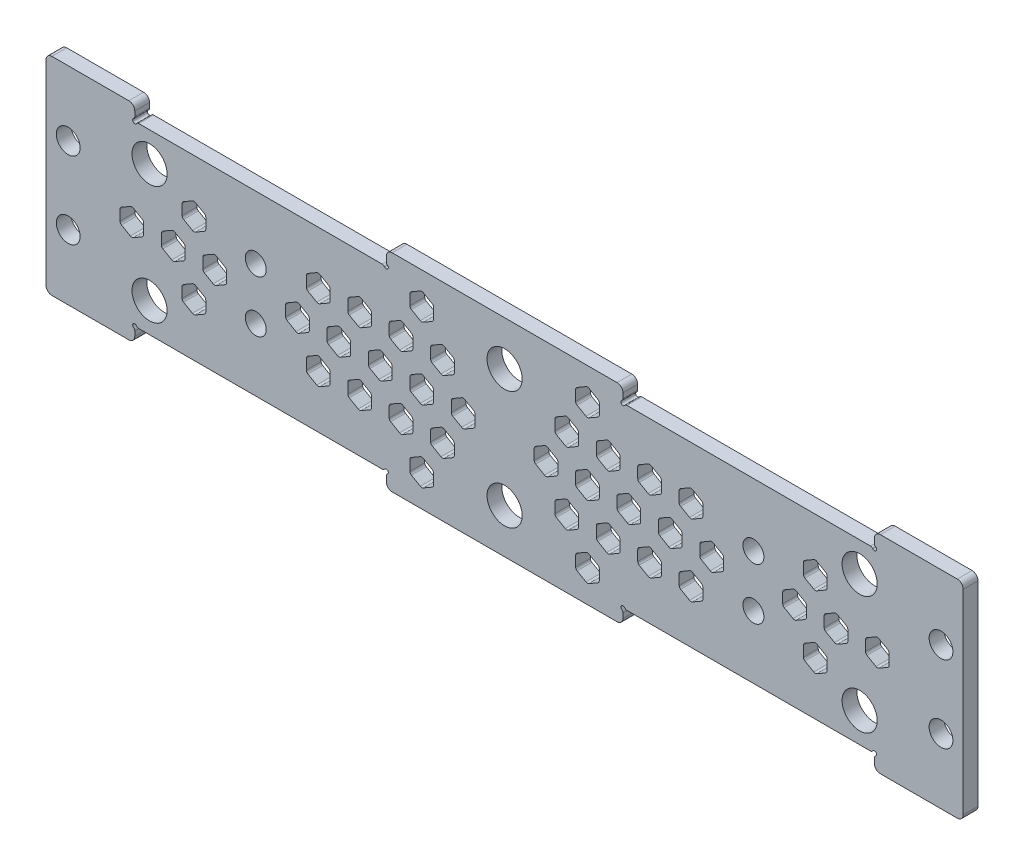
from build123d import *

# Parameters (mm, degrees)
STOCK_HAMMERSAW_START                   = 19.05
STOCK_HAMMERSAW_MULTIBODY_1_OUTLINE_R   = 3.77063
STOCK_HAMMERSAW_MULTIBODY_1_OUTLINE_R_2 = 2.5527
STOCK_HAMMERSAW_MULTIBODY_1_OUTLINE_R_3 = 2.2479
STOCK_HAMMERSAW_MULTIBODY_1_DEPTH       = 3.175
CUT_EXTRUDE1_DEPTH                      = 113.298093817
FILLET3_R                               = 0.635
LPATTERN1_COUNT                         = 11
LPATTERN1_PITCH                         = 8.89
LPATTERN1_COUNT_DIR2                    = 11
LPATTERN1_PITCH_DIR2                    = 8.89
FILLET3_OF_LPATTERN1_R                  = 0.635
MIRROR1_START                           = 19.05
MIRROR1_DEPTH                           = 3.175
SKETCH2_R                               = 0.4445
CUT_EXTRUDE2_DEPTH                      = 113.298093817
FILLET1_R                               = 0.635
FILLET2_R                               = 1.27


# Read off the part's stored shape, not the designer's step: Stock-HammerSaw Multibody-1, Mirror1
with BuildPart() as part:
    # Stock-HammerSaw Multibody-1 outline → Stock-HammerSaw Multibody-1 (new body)
    with BuildSketch(Plane.XY.offset(STOCK_HAMMERSAW_START)):
        Polygon((79.375, 50.8), (25.4, 50.8), (25.4, 53.975), (-25.4, 53.975), (-25.4, 50.8), (-79.375, 50.8), (-79.375, 53.975), (-98.425, 53.975), (-98.425, 9.525), (-79.375, 9.525), (-79.375, 12.7), (-25.4, 12.7), (-25.4, 9.525), (25.4, 9.525), (25.4, 12.7), (79.375, 12.7), (79.375, 9.525), (98.425, 9.525), (98.425, 53.975), (79.375, 53.975), align=None)
        with Locations((-76.2, 19.05)):
            Circle(STOCK_HAMMERSAW_MULTIBODY_1_OUTLINE_R, mode=Mode.SUBTRACT)
        with Locations((-93.6625, 23.495)):
            Circle(STOCK_HAMMERSAW_MULTIBODY_1_OUTLINE_R_2, mode=Mode.SUBTRACT)
        with Locations((-53.4035, 26.19375)):
            Circle(STOCK_HAMMERSAW_MULTIBODY_1_OUTLINE_R_3, mode=Mode.SUBTRACT)
        with Locations((0, 19.05)):
            Circle(STOCK_HAMMERSAW_MULTIBODY_1_OUTLINE_R, mode=Mode.SUBTRACT)
        with Locations((76.2, 19.05)):
            Circle(STOCK_HAMMERSAW_MULTIBODY_1_OUTLINE_R, mode=Mode.SUBTRACT)
        with Locations((93.6625, 23.495)):
            Circle(STOCK_HAMMERSAW_MULTIBODY_1_OUTLINE_R_2, mode=Mode.SUBTRACT)
        with Locations((53.4035, 26.19375)):
            Circle(STOCK_HAMMERSAW_MULTIBODY_1_OUTLINE_R_3, mode=Mode.SUBTRACT)
        with Locations((-93.6625, 40.005)):
            Circle(STOCK_HAMMERSAW_MULTIBODY_1_OUTLINE_R_2, mode=Mode.SUBTRACT)
        with Locations((-53.4035, 37.30625)):
            Circle(STOCK_HAMMERSAW_MULTIBODY_1_OUTLINE_R_3, mode=Mode.SUBTRACT)
        with Locations((-76.2, 44.45)):
            Circle(STOCK_HAMMERSAW_MULTIBODY_1_OUTLINE_R, mode=Mode.SUBTRACT)
        with Locations((53.4035, 37.30625)):
            Circle(STOCK_HAMMERSAW_MULTIBODY_1_OUTLINE_R_3, mode=Mode.SUBTRACT)
        with Locations((93.6625, 40.005)):
            Circle(STOCK_HAMMERSAW_MULTIBODY_1_OUTLINE_R_2, mode=Mode.SUBTRACT)
        with Locations((0, 44.45)):
            Circle(STOCK_HAMMERSAW_MULTIBODY_1_OUTLINE_R, mode=Mode.SUBTRACT)
        with Locations((76.2, 44.45)):
            Circle(STOCK_HAMMERSAW_MULTIBODY_1_OUTLINE_R, mode=Mode.SUBTRACT)
    extrude(amount=STOCK_HAMMERSAW_MULTIBODY_1_DEPTH)

    # Sketch1 → Cut-Extrude1 (cut, through all)
    with BuildSketch(Plane.XY.offset(22.225)):
        Polygon((-6.35, 30.283530316), (-6.35, 33.216469684), (-8.89, 34.682939367), (-11.43, 33.216469684), (-11.43, 30.283530316), (-8.89, 28.817060633), align=None)
    cut_extrude1 = extrude(amount=-CUT_EXTRUDE1_DEPTH, mode=Mode.SUBTRACT)

    # Fillet3
    fillet3_edges = [part.edges().sort_by_distance(p)[0] for p in [
        (-6.35, 30.283530316, 20.6375),
        (-8.89, 28.817060633, 20.6375),
        (-11.43, 30.283530316, 20.6375),
        (-11.43, 33.216469684, 20.6375),
        (-8.89, 34.682939367, 20.6375),
        (-6.35, 33.216469684, 20.6375),
    ]]
    fillet(fillet3_edges, radius=FILLET3_R)

    # LPattern1: Cut-Extrude1 11 × 11, 100 skipped
    with Locations(*[Vector(0.5000000000000003, 0.8660254037844385, 0) * (i * LPATTERN1_PITCH) + Vector(0.5, -0.8660254037844387, 0) * (j * LPATTERN1_PITCH_DIR2) for i in range(LPATTERN1_COUNT) for j in range(LPATTERN1_COUNT_DIR2) if (i, j) not in ((0, 0), (0, 1), (0, 2), (0, 3), (0, 4), (0, 5), (0, 6), (0, 7), (0, 8), (0, 9), (0, 10), (1, 0), (1, 1), (1, 2), (1, 3), (1, 4), (1, 5), (1, 6), (1, 7), (1, 8), (1, 9), (1, 10), (2, 0), (2, 1), (2, 5), (2, 6), (2, 7), (2, 8), (2, 9), (2, 10), (3, 0), (3, 1), (3, 5), (3, 6), (3, 7), (3, 8), (3, 9), (3, 10), (4, 0), (4, 1), (4, 6), (4, 7), (4, 8), (4, 9), (4, 10), (5, 0), (5, 1), (5, 2), (5, 3), (5, 7), (5, 8), (5, 9), (5, 10), (6, 0), (6, 1), (6, 2), (6, 3), (6, 4), (6, 7), (6, 8), (6, 9), (6, 10), (7, 0), (7, 1), (7, 2), (7, 3), (7, 4), (7, 5), (7, 6), (7, 7), (7, 8), (7, 9), (7, 10), (8, 0), (8, 1), (8, 2), (8, 3), (8, 4), (8, 5), (8, 6), (8, 7), (8, 10), (9, 0), (9, 1), (9, 2), (9, 3), (9, 4), (9, 5), (9, 6), (9, 7), (9, 10), (10, 0), (10, 1), (10, 2), (10, 3), (10, 4), (10, 5), (10, 6), (10, 7), (10, 8), (10, 9))]):
        add(cut_extrude1, mode=Mode.SUBTRACT)

    # Fillet3 of LPattern1
    fillet3_of_lpattern1_edges = [part.edges().sort_by_distance(p)[0] for p in [
        (11.43, 30.283530316, 20.6375),
        (8.89, 28.817060633, 20.6375),
        (6.35, 30.283530316, 20.6375),
        (6.35, 33.216469684, 20.6375),
        (8.89, 34.682939367, 20.6375),
        (11.43, 33.216469684, 20.6375),
        (15.875, 22.584564477, 20.6375),
        (13.335, 21.118094793, 20.6375),
        (10.795, 22.584564477, 20.6375),
        (10.795, 25.517503844, 20.6375),
        (13.335, 26.983973528, 20.6375),
        (15.875, 25.517503844, 20.6375),
        (20.32, 14.885598637, 20.6375),
        (17.78, 13.419128953, 20.6375),
        (15.24, 14.885598637, 20.6375),
        (15.24, 17.818538004, 20.6375),
        (17.78, 19.285007688, 20.6375),
        (20.32, 17.818538004, 20.6375),
        (15.875, 37.982496156, 20.6375),
        (13.335, 36.516026472, 20.6375),
        (10.795, 37.982496156, 20.6375),
        (10.795, 40.915435523, 20.6375),
        (13.335, 42.381905207, 20.6375),
        (15.875, 40.915435523, 20.6375),
        (20.32, 30.283530316, 20.6375),
        (17.78, 28.817060633, 20.6375),
        (15.24, 30.283530316, 20.6375),
        (15.24, 33.216469684, 20.6375),
        (17.78, 34.682939367, 20.6375),
        (20.32, 33.216469684, 20.6375),
        (24.765, 22.584564477, 20.6375),
        (22.225, 21.118094793, 20.6375),
        (19.685, 22.584564477, 20.6375),
        (19.685, 25.517503844, 20.6375),
        (22.225, 26.983973528, 20.6375),
        (24.765, 25.517503844, 20.6375),
        (20.32, 45.681461996, 20.6375),
        (17.78, 44.214992312, 20.6375),
        (15.24, 45.681461996, 20.6375),
        (15.24, 48.614401363, 20.6375),
        (17.78, 50.080871047, 20.6375),
        (20.32, 48.614401363, 20.6375),
        (24.765, 37.982496156, 20.6375),
        (22.225, 36.516026472, 20.6375),
        (19.685, 37.982496156, 20.6375),
        (19.685, 40.915435523, 20.6375),
        (22.225, 42.381905207, 20.6375),
        (24.765, 40.915435523, 20.6375),
        (29.21, 30.283530316, 20.6375),
        (26.67, 28.817060633, 20.6375),
        (24.13, 30.283530316, 20.6375),
        (24.13, 33.216469684, 20.6375),
        (26.67, 34.682939367, 20.6375),
        (29.21, 33.216469684, 20.6375),
        (33.655, 22.584564477, 20.6375),
        (31.115, 21.118094793, 20.6375),
        (28.575, 22.584564477, 20.6375),
        (28.575, 25.517503844, 20.6375),
        (31.115, 26.983973528, 20.6375),
        (33.655, 25.517503844, 20.6375),
        (33.655, 37.982496156, 20.6375),
        (31.115, 36.516026472, 20.6375),
        (28.575, 37.982496156, 20.6375),
        (28.575, 40.915435523, 20.6375),
        (31.115, 42.381905207, 20.6375),
        (33.655, 40.915435523, 20.6375),
        (38.1, 30.283530316, 20.6375),
        (35.56, 28.817060633, 20.6375),
        (33.02, 30.283530316, 20.6375),
        (33.02, 33.216469684, 20.6375),
        (35.56, 34.682939367, 20.6375),
        (38.1, 33.216469684, 20.6375),
        (42.545, 22.584564477, 20.6375),
        (40.005, 21.118094793, 20.6375),
        (37.465, 22.584564477, 20.6375),
        (37.465, 25.517503844, 20.6375),
        (40.005, 26.983973528, 20.6375),
        (42.545, 25.517503844, 20.6375),
        (42.545, 37.982496156, 20.6375),
        (40.005, 36.516026472, 20.6375),
        (37.465, 37.982496156, 20.6375),
        (37.465, 40.915435523, 20.6375),
        (40.005, 42.381905207, 20.6375),
        (42.545, 40.915435523, 20.6375),
        (46.99, 30.283530316, 20.6375),
        (44.45, 28.817060633, 20.6375),
        (41.91, 30.283530316, 20.6375),
        (41.91, 33.216469684, 20.6375),
        (44.45, 34.682939367, 20.6375),
        (46.99, 33.216469684, 20.6375),
        (64.77, 30.283530316, 20.6375),
        (62.23, 28.817060633, 20.6375),
        (59.69, 30.283530316, 20.6375),
        (59.69, 33.216469684, 20.6375),
        (62.23, 34.682939367, 20.6375),
        (64.77, 33.216469684, 20.6375),
        (69.215, 22.584564477, 20.6375),
        (66.675, 21.118094793, 20.6375),
        (64.135, 22.584564477, 20.6375),
        (64.135, 25.517503844, 20.6375),
        (66.675, 26.983973528, 20.6375),
        (69.215, 25.517503844, 20.6375),
        (69.215, 37.982496156, 20.6375),
        (66.675, 36.516026472, 20.6375),
        (64.135, 37.982496156, 20.6375),
        (64.135, 40.915435523, 20.6375),
        (66.675, 42.381905207, 20.6375),
        (69.215, 40.915435523, 20.6375),
        (73.66, 30.283530316, 20.6375),
        (71.12, 28.817060633, 20.6375),
        (68.58, 30.283530316, 20.6375),
        (68.58, 33.216469684, 20.6375),
        (71.12, 34.682939367, 20.6375),
        (73.66, 33.216469684, 20.6375),
        (82.55, 30.283530316, 20.6375),
        (80.01, 28.817060633, 20.6375),
        (77.47, 30.283530316, 20.6375),
        (77.47, 33.216469684, 20.6375),
        (80.01, 34.682939367, 20.6375),
        (82.55, 33.216469684, 20.6375),
    ]]
    fillet(fillet3_of_lpattern1_edges, radius=FILLET3_OF_LPATTERN1_R)

    # Mirror1 outline → Mirror1 (cut)
    with BuildSketch(Plane.XY.offset(MIRROR1_START)):
        with BuildLine():
            Line((-21.9075, 21.301403503), (-20.0025, 22.401255766))
            ThreePointArc((-20.0025, 22.401255766), (-19.770073869, 22.633681898), (-19.685, 22.951181898))
            Line((-19.685, 22.951181898), (-19.685, 25.150886423))
            ThreePointArc((-19.685, 25.150886423), (-19.770073869, 25.468386423), (-20.0025, 25.700812555))
            Line((-20.0025, 25.700812555), (-21.9075, 26.800664817))
            ThreePointArc((-21.9075, 26.800664817), (-22.225, 26.885738686), (-22.5425, 26.800664817))
            Line((-22.5425, 26.800664817), (-24.4475, 25.700812555))
            ThreePointArc((-24.4475, 25.700812555), (-24.679926131, 25.468386423), (-24.765, 25.150886423))
            Line((-24.765, 25.150886423), (-24.765, 22.951181898))
            ThreePointArc((-24.765, 22.951181898), (-24.679926131, 22.633681898), (-24.4475, 22.401255766))
            Line((-24.4475, 22.401255766), (-22.5425, 21.301403503))
            ThreePointArc((-22.5425, 21.301403503), (-22.225, 21.216329635), (-21.9075, 21.301403503))
        make_face()
        with BuildLine():
            Line((-24.4475, 37.799187445), (-22.5425, 36.699335183))
            ThreePointArc((-22.5425, 36.699335183), (-22.225, 36.614261314), (-21.9075, 36.699335183))
            Line((-21.9075, 36.699335183), (-20.0025, 37.799187445))
            ThreePointArc((-20.0025, 37.799187445), (-19.770073869, 38.031613577), (-19.685, 38.349113577))
            Line((-19.685, 38.349113577), (-19.685, 40.548818102))
            ThreePointArc((-19.685, 40.548818102), (-19.770073869, 40.866318102), (-20.0025, 41.098744234))
            Line((-20.0025, 41.098744234), (-21.9075, 42.198596497))
            ThreePointArc((-21.9075, 42.198596497), (-22.225, 42.283670365), (-22.5425, 42.198596497))
            Line((-22.5425, 42.198596497), (-24.4475, 41.098744234))
            ThreePointArc((-24.4475, 41.098744234), (-24.679926131, 40.866318102), (-24.765, 40.548818102))
            Line((-24.765, 40.548818102), (-24.765, 38.349113577))
            ThreePointArc((-24.765, 38.349113577), (-24.679926131, 38.031613577), (-24.4475, 37.799187445))
        make_face()
        with BuildLine():
            Line((-17.4625, 13.602437664), (-15.5575, 14.702289927))
            ThreePointArc((-15.5575, 14.702289927), (-15.325073869, 14.934716058), (-15.24, 15.252216058))
            Line((-15.24, 15.252216058), (-15.24, 17.451920584))
            ThreePointArc((-15.24, 17.451920584), (-15.325073869, 17.769420584), (-15.5575, 18.001846715))
            Line((-15.5575, 18.001846715), (-17.4625, 19.101698978))
            ThreePointArc((-17.4625, 19.101698978), (-17.78, 19.186772846), (-18.0975, 19.101698978))
            Line((-18.0975, 19.101698978), (-20.0025, 18.001846715))
            ThreePointArc((-20.0025, 18.001846715), (-20.234926131, 17.769420584), (-20.32, 17.451920584))
            Line((-20.32, 17.451920584), (-20.32, 15.252216058))
            ThreePointArc((-20.32, 15.252216058), (-20.234926131, 14.934716058), (-20.0025, 14.702289927))
            Line((-20.0025, 14.702289927), (-18.0975, 13.602437664))
            ThreePointArc((-18.0975, 13.602437664), (-17.78, 13.517363795), (-17.4625, 13.602437664))
        make_face()
        with BuildLine():
            Line((-20.0025, 45.498153285), (-18.0975, 44.398301022))
            ThreePointArc((-18.0975, 44.398301022), (-17.78, 44.313227154), (-17.4625, 44.398301022))
            Line((-17.4625, 44.398301022), (-15.5575, 45.498153285))
            ThreePointArc((-15.5575, 45.498153285), (-15.325073869, 45.730579416), (-15.24, 46.048079416))
            Line((-15.24, 46.048079416), (-15.24, 48.247783942))
            ThreePointArc((-15.24, 48.247783942), (-15.325073869, 48.565283942), (-15.5575, 48.797710073))
            Line((-15.5575, 48.797710073), (-17.4625, 49.897562336))
            ThreePointArc((-17.4625, 49.897562336), (-17.78, 49.982636205), (-18.0975, 49.897562336))
            Line((-18.0975, 49.897562336), (-20.0025, 48.797710073))
            ThreePointArc((-20.0025, 48.797710073), (-20.234926131, 48.565283942), (-20.32, 48.247783942))
            Line((-20.32, 48.247783942), (-20.32, 46.048079416))
            ThreePointArc((-20.32, 46.048079416), (-20.234926131, 45.730579416), (-20.0025, 45.498153285))
        make_face()
        with BuildLine():
            Line((-13.0175, 21.301403503), (-11.1125, 22.401255766))
            ThreePointArc((-11.1125, 22.401255766), (-10.880073869, 22.633681898), (-10.795, 22.951181898))
            Line((-10.795, 22.951181898), (-10.795, 25.150886423))
            ThreePointArc((-10.795, 25.150886423), (-10.880073869, 25.468386423), (-11.1125, 25.700812555))
            Line((-11.1125, 25.700812555), (-13.0175, 26.800664817))
            ThreePointArc((-13.0175, 26.800664817), (-13.335, 26.885738686), (-13.6525, 26.800664817))
            Line((-13.6525, 26.800664817), (-15.5575, 25.700812555))
            ThreePointArc((-15.5575, 25.700812555), (-15.789926131, 25.468386423), (-15.875, 25.150886423))
            Line((-15.875, 25.150886423), (-15.875, 22.951181898))
            ThreePointArc((-15.875, 22.951181898), (-15.789926131, 22.633681898), (-15.5575, 22.401255766))
            Line((-15.5575, 22.401255766), (-13.6525, 21.301403503))
            ThreePointArc((-13.6525, 21.301403503), (-13.335, 21.216329635), (-13.0175, 21.301403503))
        make_face()
        with BuildLine():
            Line((-15.5575, 37.799187445), (-13.6525, 36.699335183))
            ThreePointArc((-13.6525, 36.699335183), (-13.335, 36.614261314), (-13.0175, 36.699335183))
            Line((-13.0175, 36.699335183), (-11.1125, 37.799187445))
            ThreePointArc((-11.1125, 37.799187445), (-10.880073869, 38.031613577), (-10.795, 38.349113577))
            Line((-10.795, 38.349113577), (-10.795, 40.548818102))
            ThreePointArc((-10.795, 40.548818102), (-10.880073869, 40.866318102), (-11.1125, 41.098744234))
            Line((-11.1125, 41.098744234), (-13.0175, 42.198596497))
            ThreePointArc((-13.0175, 42.198596497), (-13.335, 42.283670365), (-13.6525, 42.198596497))
            Line((-13.6525, 42.198596497), (-15.5575, 41.098744234))
            ThreePointArc((-15.5575, 41.098744234), (-15.789926131, 40.866318102), (-15.875, 40.548818102))
            Line((-15.875, 40.548818102), (-15.875, 38.349113577))
            ThreePointArc((-15.875, 38.349113577), (-15.789926131, 38.031613577), (-15.5575, 37.799187445))
        make_face()
        with BuildLine():
            Line((-37.7825, 30.100221606), (-35.8775, 29.000369343))
            ThreePointArc((-35.8775, 29.000369343), (-35.56, 28.915295474), (-35.2425, 29.000369343))
            Line((-35.2425, 29.000369343), (-33.3375, 30.100221606))
            ThreePointArc((-33.3375, 30.100221606), (-33.105073869, 30.332647737), (-33.02, 30.650147737))
            Line((-33.02, 30.650147737), (-33.02, 32.849852263))
            ThreePointArc((-33.02, 32.849852263), (-33.105073869, 33.167352263), (-33.3375, 33.399778394))
            Line((-33.3375, 33.399778394), (-35.2425, 34.499630657))
            ThreePointArc((-35.2425, 34.499630657), (-35.56, 34.584704526), (-35.8775, 34.499630657))
            Line((-35.8775, 34.499630657), (-37.7825, 33.399778394))
            ThreePointArc((-37.7825, 33.399778394), (-38.014926131, 33.167352263), (-38.1, 32.849852263))
            Line((-38.1, 32.849852263), (-38.1, 30.650147737))
            ThreePointArc((-38.1, 30.650147737), (-38.014926131, 30.332647737), (-37.7825, 30.100221606))
        make_face()
        with BuildLine():
            Line((-33.3375, 37.799187445), (-31.4325, 36.699335183))
            ThreePointArc((-31.4325, 36.699335183), (-31.115, 36.614261314), (-30.7975, 36.699335183))
            Line((-30.7975, 36.699335183), (-28.8925, 37.799187445))
            ThreePointArc((-28.8925, 37.799187445), (-28.660073869, 38.031613577), (-28.575, 38.349113577))
            Line((-28.575, 38.349113577), (-28.575, 40.548818102))
            ThreePointArc((-28.575, 40.548818102), (-28.660073869, 40.866318102), (-28.8925, 41.098744234))
            Line((-28.8925, 41.098744234), (-30.7975, 42.198596497))
            ThreePointArc((-30.7975, 42.198596497), (-31.115, 42.283670365), (-31.4325, 42.198596497))
            Line((-31.4325, 42.198596497), (-33.3375, 41.098744234))
            ThreePointArc((-33.3375, 41.098744234), (-33.569926131, 40.866318102), (-33.655, 40.548818102))
            Line((-33.655, 40.548818102), (-33.655, 38.349113577))
            ThreePointArc((-33.655, 38.349113577), (-33.569926131, 38.031613577), (-33.3375, 37.799187445))
        make_face()
        with BuildLine():
            Line((-20.0025, 30.100221606), (-18.0975, 29.000369343))
            ThreePointArc((-18.0975, 29.000369343), (-17.78, 28.915295474), (-17.4625, 29.000369343))
            Line((-17.4625, 29.000369343), (-15.5575, 30.100221606))
            ThreePointArc((-15.5575, 30.100221606), (-15.325073869, 30.332647737), (-15.24, 30.650147737))
            Line((-15.24, 30.650147737), (-15.24, 32.849852263))
            ThreePointArc((-15.24, 32.849852263), (-15.325073869, 33.167352263), (-15.5575, 33.399778394))
            Line((-15.5575, 33.399778394), (-17.4625, 34.499630657))
            ThreePointArc((-17.4625, 34.499630657), (-17.78, 34.584704526), (-18.0975, 34.499630657))
            Line((-18.0975, 34.499630657), (-20.0025, 33.399778394))
            ThreePointArc((-20.0025, 33.399778394), (-20.234926131, 33.167352263), (-20.32, 32.849852263))
            Line((-20.32, 32.849852263), (-20.32, 30.650147737))
            ThreePointArc((-20.32, 30.650147737), (-20.234926131, 30.332647737), (-20.0025, 30.100221606))
        make_face()
        with BuildLine():
            Line((-33.655, 25.150886423), (-33.655, 22.951181898))
            ThreePointArc((-33.655, 22.951181898), (-33.569926131, 22.633681898), (-33.3375, 22.401255766))
            Line((-33.3375, 22.401255766), (-31.4325, 21.301403503))
            ThreePointArc((-31.4325, 21.301403503), (-31.115, 21.216329635), (-30.7975, 21.301403503))
            Line((-30.7975, 21.301403503), (-28.8925, 22.401255766))
            ThreePointArc((-28.8925, 22.401255766), (-28.660073869, 22.633681898), (-28.575, 22.951181898))
            Line((-28.575, 22.951181898), (-28.575, 25.150886423))
            ThreePointArc((-28.575, 25.150886423), (-28.660073869, 25.468386423), (-28.8925, 25.700812555))
            Line((-28.8925, 25.700812555), (-30.7975, 26.800664817))
            ThreePointArc((-30.7975, 26.800664817), (-31.115, 26.885738686), (-31.4325, 26.800664817))
            Line((-31.4325, 26.800664817), (-33.3375, 25.700812555))
            ThreePointArc((-33.3375, 25.700812555), (-33.569926131, 25.468386423), (-33.655, 25.150886423))
        make_face()
        with BuildLine():
            Line((-44.7675, 34.499630657), (-46.6725, 33.399778394))
            ThreePointArc((-46.6725, 33.399778394), (-46.904926131, 33.167352263), (-46.99, 32.849852263))
            Line((-46.99, 32.849852263), (-46.99, 30.650147737))
            ThreePointArc((-46.99, 30.650147737), (-46.904926131, 30.332647737), (-46.6725, 30.100221606))
            Line((-46.6725, 30.100221606), (-44.7675, 29.000369343))
            ThreePointArc((-44.7675, 29.000369343), (-44.45, 28.915295474), (-44.1325, 29.000369343))
            Line((-44.1325, 29.000369343), (-42.2275, 30.100221606))
            ThreePointArc((-42.2275, 30.100221606), (-41.995073869, 30.332647737), (-41.91, 30.650147737))
            Line((-41.91, 30.650147737), (-41.91, 32.849852263))
            ThreePointArc((-41.91, 32.849852263), (-41.995073869, 33.167352263), (-42.2275, 33.399778394))
            Line((-42.2275, 33.399778394), (-44.1325, 34.499630657))
            ThreePointArc((-44.1325, 34.499630657), (-44.45, 34.584704526), (-44.7675, 34.499630657))
        make_face()
        with BuildLine():
            Line((-28.8925, 30.100221606), (-26.9875, 29.000369343))
            ThreePointArc((-26.9875, 29.000369343), (-26.67, 28.915295474), (-26.3525, 29.000369343))
            Line((-26.3525, 29.000369343), (-24.4475, 30.100221606))
            ThreePointArc((-24.4475, 30.100221606), (-24.215073869, 30.332647737), (-24.13, 30.650147737))
            Line((-24.13, 30.650147737), (-24.13, 32.849852263))
            ThreePointArc((-24.13, 32.849852263), (-24.215073869, 33.167352263), (-24.4475, 33.399778394))
            Line((-24.4475, 33.399778394), (-26.3525, 34.499630657))
            ThreePointArc((-26.3525, 34.499630657), (-26.67, 34.584704526), (-26.9875, 34.499630657))
            Line((-26.9875, 34.499630657), (-28.8925, 33.399778394))
            ThreePointArc((-28.8925, 33.399778394), (-29.124926131, 33.167352263), (-29.21, 32.849852263))
            Line((-29.21, 32.849852263), (-29.21, 30.650147737))
            ThreePointArc((-29.21, 30.650147737), (-29.124926131, 30.332647737), (-28.8925, 30.100221606))
        make_face()
        with BuildLine():
            Line((-42.2275, 37.799187445), (-40.3225, 36.699335183))
            ThreePointArc((-40.3225, 36.699335183), (-40.005, 36.614261314), (-39.6875, 36.699335183))
            Line((-39.6875, 36.699335183), (-37.7825, 37.799187445))
            ThreePointArc((-37.7825, 37.799187445), (-37.550073869, 38.031613577), (-37.465, 38.349113577))
            Line((-37.465, 38.349113577), (-37.465, 40.548818102))
            ThreePointArc((-37.465, 40.548818102), (-37.550073869, 40.866318102), (-37.7825, 41.098744234))
            Line((-37.7825, 41.098744234), (-39.6875, 42.198596497))
            ThreePointArc((-39.6875, 42.198596497), (-40.005, 42.283670365), (-40.3225, 42.198596497))
            Line((-40.3225, 42.198596497), (-42.2275, 41.098744234))
            ThreePointArc((-42.2275, 41.098744234), (-42.459926131, 40.866318102), (-42.545, 40.548818102))
            Line((-42.545, 40.548818102), (-42.545, 38.349113577))
            ThreePointArc((-42.545, 38.349113577), (-42.459926131, 38.031613577), (-42.2275, 37.799187445))
        make_face()
        with BuildLine():
            Line((-40.3225, 26.800664817), (-42.2275, 25.700812555))
            ThreePointArc((-42.2275, 25.700812555), (-42.459926131, 25.468386423), (-42.545, 25.150886423))
            Line((-42.545, 25.150886423), (-42.545, 22.951181898))
            ThreePointArc((-42.545, 22.951181898), (-42.459926131, 22.633681898), (-42.2275, 22.401255766))
            Line((-42.2275, 22.401255766), (-40.3225, 21.301403503))
            ThreePointArc((-40.3225, 21.301403503), (-40.005, 21.216329635), (-39.6875, 21.301403503))
            Line((-39.6875, 21.301403503), (-37.7825, 22.401255766))
            ThreePointArc((-37.7825, 22.401255766), (-37.550073869, 22.633681898), (-37.465, 22.951181898))
            Line((-37.465, 22.951181898), (-37.465, 25.150886423))
            ThreePointArc((-37.465, 25.150886423), (-37.550073869, 25.468386423), (-37.7825, 25.700812555))
            Line((-37.7825, 25.700812555), (-39.6875, 26.800664817))
            ThreePointArc((-39.6875, 26.800664817), (-40.005, 26.885738686), (-40.3225, 26.800664817))
        make_face()
        with BuildLine():
            Line((-64.4525, 30.100221606), (-62.5475, 29.000369343))
            ThreePointArc((-62.5475, 29.000369343), (-62.23, 28.915295474), (-61.9125, 29.000369343))
            Line((-61.9125, 29.000369343), (-60.0075, 30.100221606))
            ThreePointArc((-60.0075, 30.100221606), (-59.775073869, 30.332647737), (-59.69, 30.650147737))
            Line((-59.69, 30.650147737), (-59.69, 32.849852263))
            ThreePointArc((-59.69, 32.849852263), (-59.775073869, 33.167352263), (-60.0075, 33.399778394))
            Line((-60.0075, 33.399778394), (-61.9125, 34.499630657))
            ThreePointArc((-61.9125, 34.499630657), (-62.23, 34.584704526), (-62.5475, 34.499630657))
            Line((-62.5475, 34.499630657), (-64.4525, 33.399778394))
            ThreePointArc((-64.4525, 33.399778394), (-64.684926131, 33.167352263), (-64.77, 32.849852263))
            Line((-64.77, 32.849852263), (-64.77, 30.650147737))
            ThreePointArc((-64.77, 30.650147737), (-64.684926131, 30.332647737), (-64.4525, 30.100221606))
        make_face()
        with BuildLine():
            Line((-66.9925, 26.800664817), (-68.8975, 25.700812555))
            ThreePointArc((-68.8975, 25.700812555), (-69.129926131, 25.468386423), (-69.215, 25.150886423))
            Line((-69.215, 25.150886423), (-69.215, 22.951181898))
            ThreePointArc((-69.215, 22.951181898), (-69.129926131, 22.633681898), (-68.8975, 22.401255766))
            Line((-68.8975, 22.401255766), (-66.9925, 21.301403503))
            ThreePointArc((-66.9925, 21.301403503), (-66.675, 21.216329635), (-66.3575, 21.301403503))
            Line((-66.3575, 21.301403503), (-64.4525, 22.401255766))
            ThreePointArc((-64.4525, 22.401255766), (-64.220073869, 22.633681898), (-64.135, 22.951181898))
            Line((-64.135, 22.951181898), (-64.135, 25.150886423))
            ThreePointArc((-64.135, 25.150886423), (-64.220073869, 25.468386423), (-64.4525, 25.700812555))
            Line((-64.4525, 25.700812555), (-66.3575, 26.800664817))
            ThreePointArc((-66.3575, 26.800664817), (-66.675, 26.885738686), (-66.9925, 26.800664817))
        make_face()
        with BuildLine():
            Line((-68.8975, 37.799187445), (-66.9925, 36.699335183))
            ThreePointArc((-66.9925, 36.699335183), (-66.675, 36.614261314), (-66.3575, 36.699335183))
            Line((-66.3575, 36.699335183), (-64.4525, 37.799187445))
            ThreePointArc((-64.4525, 37.799187445), (-64.220073869, 38.031613577), (-64.135, 38.349113577))
            Line((-64.135, 38.349113577), (-64.135, 40.548818102))
            ThreePointArc((-64.135, 40.548818102), (-64.220073869, 40.866318102), (-64.4525, 41.098744234))
            Line((-64.4525, 41.098744234), (-66.3575, 42.198596497))
            ThreePointArc((-66.3575, 42.198596497), (-66.675, 42.283670365), (-66.9925, 42.198596497))
            Line((-66.9925, 42.198596497), (-68.8975, 41.098744234))
            ThreePointArc((-68.8975, 41.098744234), (-69.129926131, 40.866318102), (-69.215, 40.548818102))
            Line((-69.215, 40.548818102), (-69.215, 38.349113577))
            ThreePointArc((-69.215, 38.349113577), (-69.129926131, 38.031613577), (-68.8975, 37.799187445))
        make_face()
        with BuildLine():
            Line((-82.2325, 30.100221606), (-80.3275, 29.000369343))
            ThreePointArc((-80.3275, 29.000369343), (-80.01, 28.915295474), (-79.6925, 29.000369343))
            Line((-79.6925, 29.000369343), (-77.7875, 30.100221606))
            ThreePointArc((-77.7875, 30.100221606), (-77.555073869, 30.332647737), (-77.47, 30.650147737))
            Line((-77.47, 30.650147737), (-77.47, 32.849852263))
            ThreePointArc((-77.47, 32.849852263), (-77.555073869, 33.167352263), (-77.7875, 33.399778394))
            Line((-77.7875, 33.399778394), (-79.6925, 34.499630657))
            ThreePointArc((-79.6925, 34.499630657), (-80.01, 34.584704526), (-80.3275, 34.499630657))
            Line((-80.3275, 34.499630657), (-82.2325, 33.399778394))
            ThreePointArc((-82.2325, 33.399778394), (-82.464926131, 33.167352263), (-82.55, 32.849852263))
            Line((-82.55, 32.849852263), (-82.55, 30.650147737))
            ThreePointArc((-82.55, 30.650147737), (-82.464926131, 30.332647737), (-82.2325, 30.100221606))
        make_face()
        with BuildLine():
            Line((-73.3425, 30.100221606), (-71.4375, 29.000369343))
            ThreePointArc((-71.4375, 29.000369343), (-71.12, 28.915295474), (-70.8025, 29.000369343))
            Line((-70.8025, 29.000369343), (-68.8975, 30.100221606))
            ThreePointArc((-68.8975, 30.100221606), (-68.665073869, 30.332647737), (-68.58, 30.650147737))
            Line((-68.58, 30.650147737), (-68.58, 32.849852263))
            ThreePointArc((-68.58, 32.849852263), (-68.665073869, 33.167352263), (-68.8975, 33.399778394))
            Line((-68.8975, 33.399778394), (-70.8025, 34.499630657))
            ThreePointArc((-70.8025, 34.499630657), (-71.12, 34.584704526), (-71.4375, 34.499630657))
            Line((-71.4375, 34.499630657), (-73.3425, 33.399778394))
            ThreePointArc((-73.3425, 33.399778394), (-73.574926131, 33.167352263), (-73.66, 32.849852263))
            Line((-73.66, 32.849852263), (-73.66, 30.650147737))
            ThreePointArc((-73.66, 30.650147737), (-73.574926131, 30.332647737), (-73.3425, 30.100221606))
        make_face()
    extrude(amount=MIRROR1_DEPTH, mode=Mode.SUBTRACT)

    # Sketch2 → Cut-Extrude2 (cut, through all)
    with BuildSketch(Plane.XY.offset(22.225)):
        with Locations((-79.375, 50.8)):
            Circle(SKETCH2_R)
        with Locations((-25.4, 50.8)):
            Circle(SKETCH2_R)
        with Locations((-79.375, 12.7)):
            Circle(SKETCH2_R)
        with Locations((-25.4, 12.7)):
            Circle(SKETCH2_R)
        with Locations((25.4, 12.7)):
            Circle(SKETCH2_R)
        with Locations((79.375, 12.7)):
            Circle(SKETCH2_R)
        with Locations((79.375, 50.8)):
            Circle(SKETCH2_R)
        with Locations((25.4, 50.8)):
            Circle(SKETCH2_R)
    extrude(amount=-CUT_EXTRUDE2_DEPTH, mode=Mode.SUBTRACT)

    # Fillet1
    fillet1_edges = [part.edges().sort_by_distance(p)[0] for p in [
        (25.4, 12.2555, 20.6375),
        (79.375, 12.2555, 20.6375),
        (25.4, 51.2445, 20.6375),
        (79.375, 51.2445, 20.6375),
        (-25.4, 12.2555, 20.6375),
        (-79.375, 12.2555, 20.6375),
        (-25.4, 51.2445, 20.6375),
        (-79.375, 51.2445, 20.6375),
        (25.8445, 12.7, 20.6375),
        (-25.8445, 12.7, 20.6375),
        (-78.9305, 12.7, 20.6375),
        (-25.8445, 50.8, 20.6375),
        (78.9305, 12.7, 20.6375),
        (78.9305, 50.8, 20.6375),
        (25.8445, 50.8, 20.6375),
        (-78.9305, 50.8, 20.6375),
    ]]
    fillet(fillet1_edges, radius=FILLET1_R)

    # Fillet2
    fillet2_edges = [part.edges().sort_by_distance(p)[0] for p in [
        (-98.425, 53.975, 20.6375),
        (-79.375, 53.975, 20.6375),
        (-25.4, 53.975, 20.6375),
        (-79.375, 9.525, 20.6375),
        (-98.425, 9.525, 20.6375),
        (-25.4, 9.525, 20.6375),
        (79.375, 53.975, 20.6375),
        (98.425, 53.975, 20.6375),
        (25.4, 53.975, 20.6375),
        (98.425, 9.525, 20.6375),
        (79.375, 9.525, 20.6375),
        (25.4, 9.525, 20.6375),
    ]]
    fillet(fillet2_edges, radius=FILLET2_R)


solid = part.part
